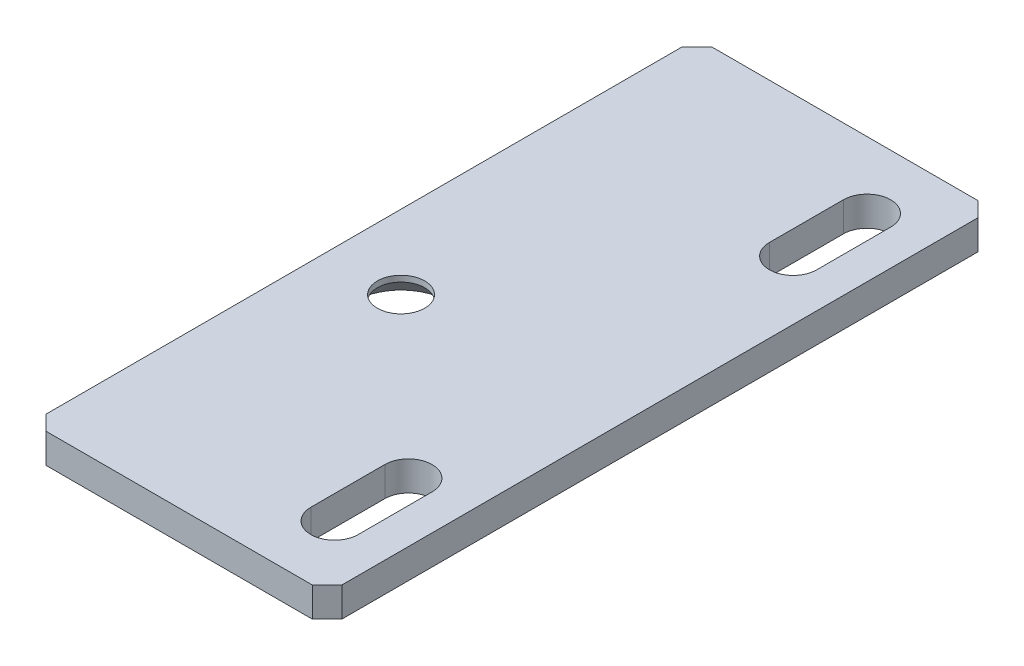
from build123d import *

# Parameters (mm, degrees)
SKETCH1_W        = 20
SKETCH1_H        = 45
BASE_DEPTH       = 2
SCREWSLOTS_DEPTH = 25.703238654
CHAMFER1_SIZE    = 1


with BuildPart() as part:
    # Sketch1 → Base (new body)
    with BuildSketch(Plane(origin=(0, 0, 0), x_dir=(1, 0, 0), z_dir=(0, 1, 0))):
        Rectangle(SKETCH1_W, SKETCH1_H)
    extrude(amount=BASE_DEPTH)

    # Sketch6 → ScrewSlots (cut, through all)
    with BuildSketch(Plane(origin=(0, 2, 0), x_dir=(1, 0, 0), z_dir=(0, 1, 0))):
        with BuildLine():
            Line((7.6, 18), (7.6, 13))
            ThreePointArc((7.6, 13), (6, 11.4), (4.4, 13))
            Line((4.4, 13), (4.4, 18))
            ThreePointArc((4.4, 18), (6, 19.6), (7.6, 18))
        make_face()
        with BuildLine():
            Line((7.6, -13), (7.6, -18))
            ThreePointArc((7.6, -18), (6, -19.6), (4.4, -18))
            Line((4.4, -18), (4.4, -13))
            ThreePointArc((4.4, -13), (6, -11.4), (7.6, -13))
        make_face()
    extrude(amount=-SCREWSLOTS_DEPTH, mode=Mode.SUBTRACT)

    # Sketch5 → PulleyHole (revolve, cut)
    with BuildSketch(Plane(origin=(-5, 0, 2.5), x_dir=(0, 0, -1), z_dir=(1, 0, 0))):
        Polygon((0, 0), (0, 2), (1.6, 2), (1.6, 1.6), (3.2, 0), align=None)
    revolve(axis=Axis((-5, -6.35, 2.5), (0, 1, 0)), mode=Mode.SUBTRACT)

    # Chamfer1
    chamfer1_edges = [part.edges().sort_by_distance(p)[0] for p in [
        (-10, 1, -22.5),
        (10, 1, -22.5),
        (10, 1, 22.5),
        (-10, 1, 22.5),
    ]]
    chamfer(chamfer1_edges, length=CHAMFER1_SIZE)


solid = part.part
